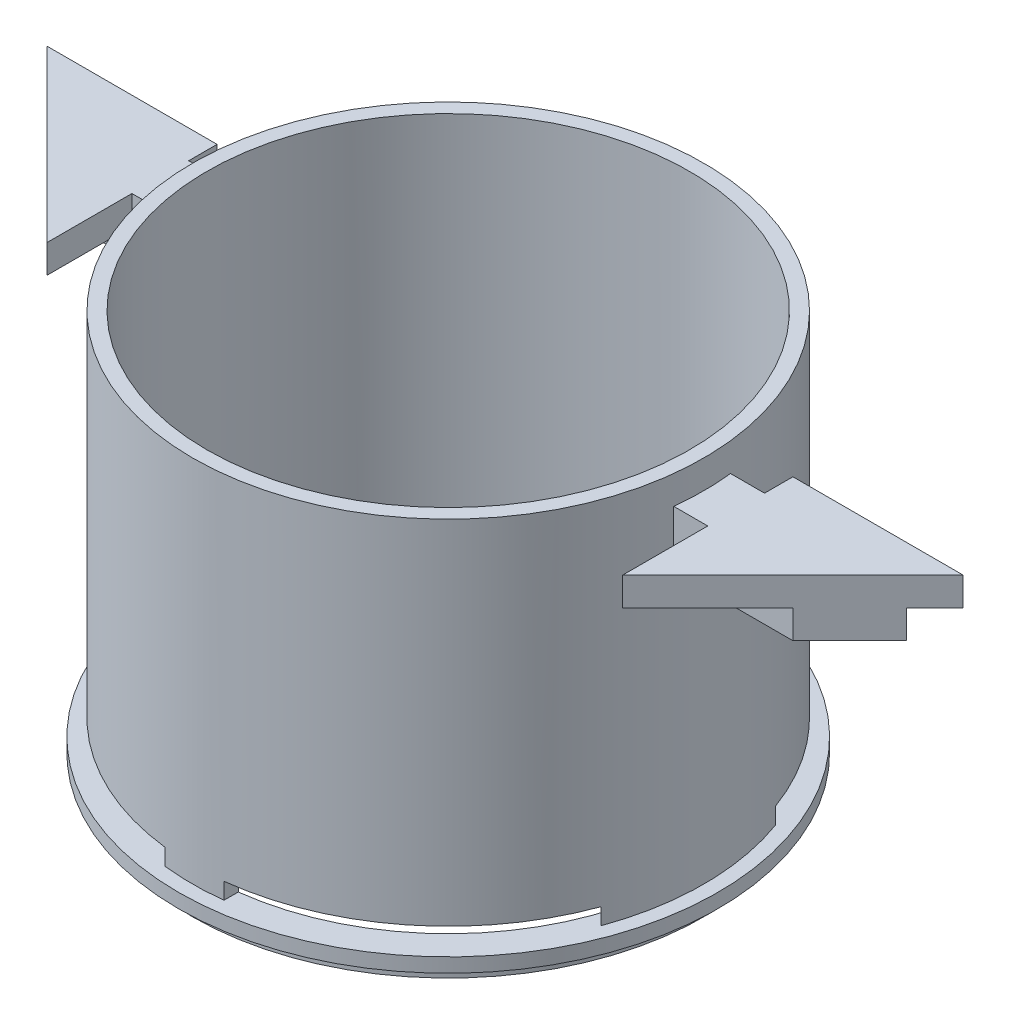
from build123d import *

# Parameters (mm, degrees)
SKETCH1_R               = 57.15
BOSS_EXTRUDE1_DEPTH     = 88.9
SKETCH2_R               = 53.975
CUT_EXTRUDE1_DEPTH      = 121.147638345
CUT_EXTRUDE4_DEPTH      = 121.147638345
CUT_EXTRUDE4_DEPTH_BACK = 121.147638345
SKETCH6_W               = 47.117
SKETCH6_H               = 3.683
BOSS_EXTRUDE7_START     = 3.175
SKETCH10_R              = 60.325
SKETCH10_R_2            = 57.15
BOSS_EXTRUDE7_DEPTH     = 3.175
BOSS_EXTRUDE6_START     = 12.7
BOSS_EXTRUDE6_DEPTH     = 12.7
BOSS_EXTRUDE8_DEPTH     = 6.35


with BuildPart() as part:
    # Sketch1 → Boss-Extrude1 (new body)
    with BuildSketch(Plane(origin=(0, 0, 0), x_dir=(1, 0, 0), z_dir=(0, 1, 0))):
        Circle(SKETCH1_R)
    extrude(amount=BOSS_EXTRUDE1_DEPTH)

    # Sketch2 → Cut-Extrude1 (cut, through all)
    with BuildSketch(Plane(origin=(0, 88.9, 0), x_dir=(1, 0, 0), z_dir=(0, 1, 0))):
        Circle(SKETCH2_R)
    extrude(amount=-CUT_EXTRUDE1_DEPTH, mode=Mode.SUBTRACT)

    # Sketch6 → Cut-Extrude4 (cut, two sides: drawn at the far end of the back side and taken through both)
    with BuildSketch(Plane.XY.offset(-CUT_EXTRUDE4_DEPTH_BACK)):
        with Locations((-30.1625, 8.1915)):
            Rectangle(SKETCH6_W, SKETCH6_H)
        with Locations((30.1625, 8.1915)):
            Rectangle(SKETCH6_W, SKETCH6_H)
    extrude(amount=CUT_EXTRUDE4_DEPTH + CUT_EXTRUDE4_DEPTH_BACK, mode=Mode.SUBTRACT)

    # Sketch10 → Boss-Extrude7 (add)
    with BuildSketch(Plane(origin=(0, 0, 0), x_dir=(1, 0, 0), z_dir=(0, 1, 0)).offset(BOSS_EXTRUDE7_START)):
        Circle(SKETCH10_R)
        Circle(SKETCH10_R_2, mode=Mode.SUBTRACT)
    extrude(amount=BOSS_EXTRUDE7_DEPTH)

    # Sketch9 → Boss-Extrude6 (add)
    with BuildSketch(Plane(origin=(0, 69.85, 0), x_dir=(1, 0, 0), z_dir=(0, 1, 0)).offset(BOSS_EXTRUDE6_START)):
        with BuildLine():
            Line((-83.4525636, -6.35), (-53.600169076, -6.35))
            ThreePointArc((-53.600169076, -6.35), (-53.975, 0), (-53.600169076, 6.35))
            Line((-53.600169076, 6.35), (-96.1525636, 6.35))
            Line((-96.1525636, 6.35), (-83.4525636, -6.35))
        make_face()
    boss_extrude6 = extrude(amount=-BOSS_EXTRUDE6_DEPTH)

    # Sketch11 → Boss-Extrude8 (add)
    with BuildSketch(Plane(origin=(0, 82.55, 0), x_dir=(1, 0, 0), z_dir=(0, 1, 0))):
        Polygon((-64.4025636, -25.4), (-64.4025636, 12.7), (-102.5025636, 12.7), align=None)
    boss_extrude8 = extrude(amount=-BOSS_EXTRUDE8_DEPTH)

    # Mirror1: Boss-Extrude6, Boss-Extrude8 across plane
    add(boss_extrude6.mirror(Plane(origin=(0, 0, 0), x_dir=(0, 0, 1), z_dir=(1, 0, 0))))
    add(boss_extrude8.mirror(Plane(origin=(0, 0, 0), x_dir=(0, 0, 1), z_dir=(1, 0, 0))))


solid = part.part
